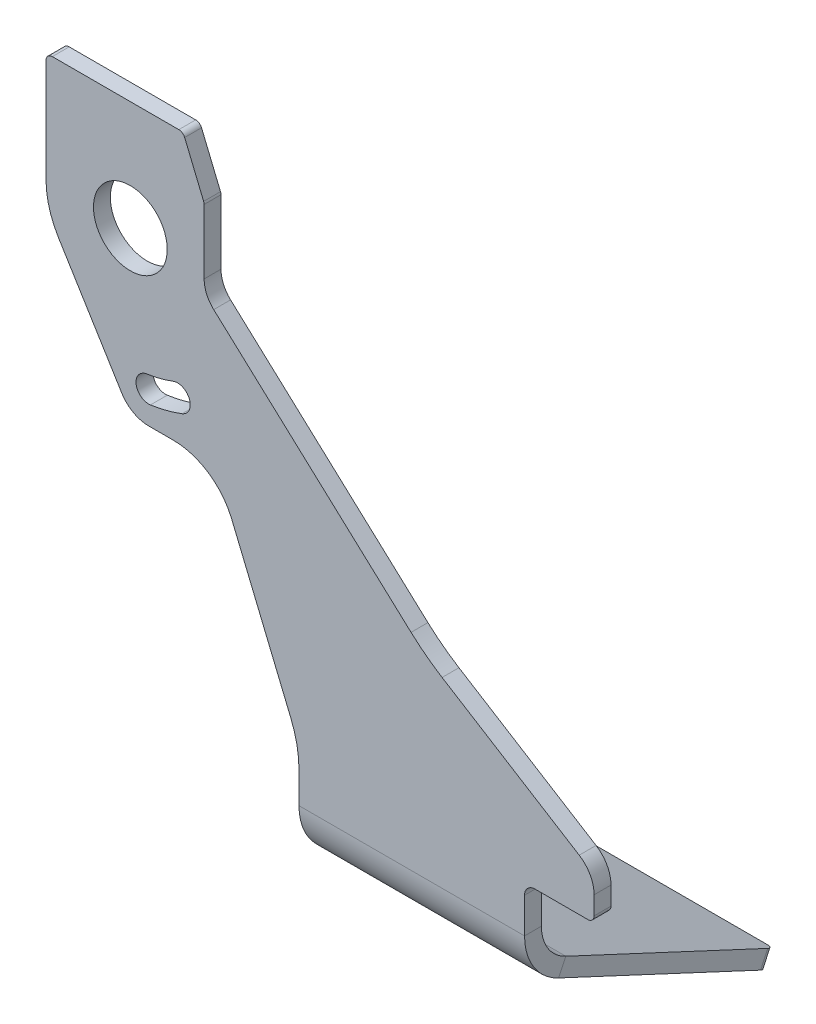
from build123d import *

# Parameters (mm, degrees)
SKETCH1_R              = 17.5
BASE_EXTRUDE_DEPTH     = 8
PROCESS_BENDS1_START   = 80
PROCESS_BENDS1_DEPTH   = 107
PROCESS_BENDS1_2_DEPTH = 107
PROCESS_BENDS1_START_2 = -196
PROCESS_BENDS1_3_DEPTH = 34.029061455


with BuildPart() as part:
    # Sketch1 → Base-Extrude (new body)
    with BuildSketch(Plane.XY):
        with BuildLine():
            Line((83, -332.5), (184, -332.5))
            ThreePointArc((184, -332.5), (186.121320344, -331.621320344), (187, -329.5))
            Line((187, -329.5), (187, -180.5))
            ThreePointArc((187, -180.5), (188.464466094, -176.964466094), (192, -175.5))
            Line((192, -175.5), (217, -175.5))
            ThreePointArc((217, -175.5), (219.121320344, -174.621320344), (220, -172.5))
            Line((220, -172.5), (220, -163.832674563))
            ThreePointArc((220, -163.832674563), (218.112603612, -156.548470658), (212.925383131, -151.097357439))
            Line((212.925383131, -151.097357439), (147.880138289, -110.618704164))
            ThreePointArc((147.880138289, -110.618704164), (140.259841851, -105.372411008), (133.157005065, -99.444323689))
            Line((133.157005065, -99.444323689), (39.541737093, -13.661735283))
            ThreePointArc((39.541737093, -13.661735283), (36.185639292, -8.978306226), (35, -3.339852568))
            Line((35, -3.339852568), (35, 27.261127274))
            ThreePointArc((35, 27.261127274), (34.942355841, 27.84639824), (34.771638598, 28.409177571))
            Line((34.771638598, 28.409177571), (25.767102684, 50.148050297))
            ThreePointArc((25.767102684, 50.148050297), (24.662174785, 51.494408837), (22.995464086, 52))
            Line((22.995464086, 52), (-37, 52))
            ThreePointArc((-37, 52), (-39.121320344, 51.121320344), (-40, 49))
            Line((-40, 49), (-40, 0))
            ThreePointArc((-40, 0), (-38.490793042, -10.883880327), (-34.077057451, -20.946459259))
            Line((-34.077057451, -20.946459259), (-4.080577734, -69.746676518))
            ThreePointArc((-4.080577734, -69.746676518), (1.377930614, -74.984191681), (8.69831881, -76.891754296))
            Line((8.69831881, -76.891754296), (20.352408817, -76.891754296))
            ThreePointArc((20.352408817, -76.891754296), (37.019515808, -81.947665927), (48.068794793, -95.411251325))
            Line((48.068794793, -95.411251325), (76.193976626, -163.311446751))
            ThreePointArc((76.193976626, -163.311446751), (79.03926402, -172.691102268), (80, -182.445618369))
            Line((80, -182.445618369), (80, -329.5))
            ThreePointArc((80, -329.5), (80.878679656, -331.621320344), (83, -332.5))
        make_face()
        Circle(SKETCH1_R, mode=Mode.SUBTRACT)
        with BuildLine():
            ThreePointArc((7.863280204, -55.950145884), (14.146470229, -54.700341681), (20.247789149, -52.747294097))
            ThreePointArc((20.247789149, -52.747294097), (27.999479406, -56.198568959), (24.548204544, -63.950259215))
            ThreePointArc((24.548204544, -63.950259215), (17.151030278, -66.318113366), (9.533357416, -67.833362709))
            ThreePointArc((9.533357416, -67.833362709), (2.756710398, -62.726792902), (7.863280204, -55.950145884))
        make_face(mode=Mode.SUBTRACT)
    extrude(amount=-BASE_EXTRUDE_DEPTH)

    # Process-Bends1: read off the stored shape, not the designer's step
    # Process-Bends1 outline → Process-Bends1 (cut)
    with BuildSketch(Plane.YZ.offset(PROCESS_BENDS1_START)):
        with BuildLine():
            Line((-332.5, -8), (-216.824957909, -8))
            ThreePointArc((-216.824957909, -8), (-207.812045211, -2.077037206), (-197.229039967, 0))
            Line((-197.229039967, 0), (-332.5, 0))
            Line((-332.5, 0), (-332.5, -8))
        make_face()
    extrude(amount=PROCESS_BENDS1_DEPTH, mode=Mode.SUBTRACT)

    # Process-Bends1 2 outline → Process-Bends1 2 (add)
    with BuildSketch(Plane.YZ.offset(PROCESS_BENDS1_START)):
        with BuildLine():
            Line((-268.556535875, -114.70866427), (-261.306073579, -118.089610364))
            Line((-261.306073579, -118.089610364), (-215.355195707, -19.547634765))
            ThreePointArc((-215.355195707, -19.547634765), (-207.975032134, -11.132171084), (-197.229039967, -8))
            Line((-197.229039967, -8), (-216.824957909, -8))
            ThreePointArc((-216.824957909, -8), (-220.083053817, -11.823039502), (-222.605658004, -16.166688671))
            Line((-222.605658004, -16.166688671), (-268.556535875, -114.70866427))
        make_face()
    extrude(amount=PROCESS_BENDS1_2_DEPTH)

    # Process-Bends1 3 outline → Process-Bends1 3 (cut)
    with BuildSketch(Plane(origin=(0, 0, 0), x_dir=(1, 0, 0), z_dir=(0, 0.9063077870366512, -0.42261826174069705)).offset(PROCESS_BENDS1_START_2)):
        with BuildLine():
            Line((187, 217.458252039), (184, 217.458252039))
            ThreePointArc((184, 217.458252039), (186.121320344, 216.579572383), (187, 214.458252039))
            Line((187, 214.458252039), (187, 217.458252039))
        make_face()
        with BuildLine():
            ThreePointArc((80, 214.458252039), (80.878679656, 216.579572383), (83, 217.458252039))
            Line((83, 217.458252039), (80, 217.458252039))
            Line((80, 217.458252039), (80, 214.458252039))
        make_face()
    extrude(amount=PROCESS_BENDS1_3_DEPTH, mode=Mode.SUBTRACT)


solid = part.part
